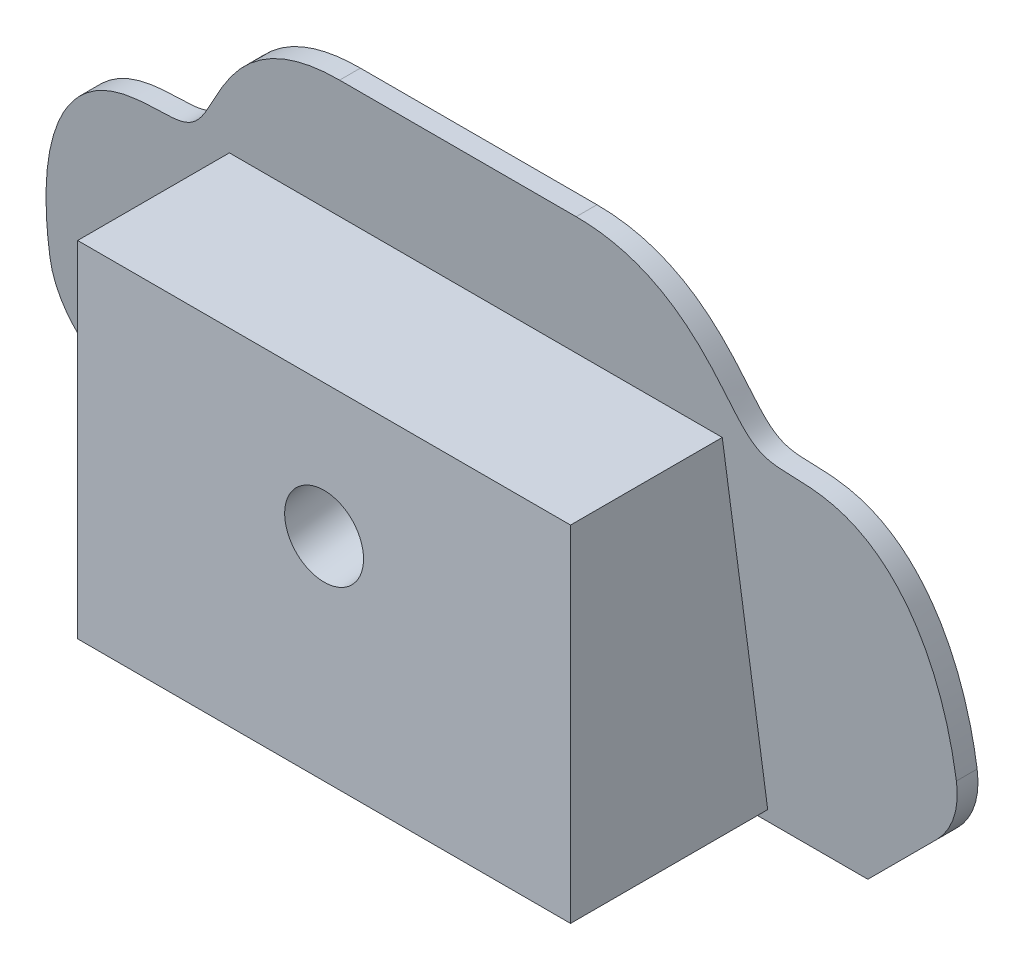
from build123d import *

# Parameters (mm, degrees)
BOSS_EXTRUDE1_START     = -25
BOSS_EXTRUDE1_DEPTH     = 50
CUT_EXTRUDE1_DEPTH      = 341.53226913
CUT_EXTRUDE1_DEPTH_BACK = 341.53226913
BOSS_EXTRUDE2_DEPTH     = 125
CUT_EXTRUDE2_DEPTH      = 356.316937075
CUT_EXTRUDE2_DEPTH_BACK = 356.316937075
SKETCH4_R               = 20
CUT_EXTRUDE3_DEPTH      = 356.316937075
CUT_EXTRUDE3_DEPTH_BACK = 356.316937075
SKETCH6_R               = 12.5


# Read off the part's stored shape, not the designer's step: Boss-Extrude1
with BuildPart() as part:
    # Boss-Extrude1 outline → Boss-Extrude1 (new body)
    with BuildSketch(Plane.XY.offset(BOSS_EXTRUDE1_START)):
        with BuildLine():
            Line((175, 0), (215.218833807, 40.218833807))
            ThreePointArc((215.218833807, 40.218833807), (226.057471223, 56.440000887), (229.863494748, 75.574172084))
            add(Edge.make_bspline(
                [(229.863494748, 75.574172084), (229.863497015, 220.574172084), (130.657195822, 208), (130.657198498, 108), (160, 250), (60, 250)],
                knots=[0, 0, 0, 0, 0, 0, 1, 1, 1, 1, 1, 1], degree=5))
            Line((60, 250), (-60, 250))
            add(Edge.make_bspline(
                [(-60, 250), (-160, 250), (-130.657198498, 108), (-130.657195822, 208), (-229.863497015, 220.574172084), (-229.863494748, 75.574172084)],
                knots=[0, 0, 0, 0, 0, 0, 1, 1, 1, 1, 1, 1], degree=5))
            ThreePointArc((-229.863494748, 75.574172084), (-226.057471223, 56.440000887), (-215.218833807, 40.218833807))
            Line((-215.218833807, 40.218833807), (-175, 0))
            Line((-175, 0), (175, 0))
        make_face()
    extrude(amount=BOSS_EXTRUDE1_DEPTH)

    # Sketch2 → Cut-Extrude1 (cut, two sides: drawn at the far end of the back side and taken through both)
    with BuildSketch(Plane(origin=(0, 0, 0), x_dir=(0, 0, -1), z_dir=(1, 0, 0)).offset(-CUT_EXTRUDE1_DEPTH_BACK)):
        Polygon((23.039732542, -10), (-12.506441807, 260), (35, 260), (35, -10), align=None)
        Polygon((-23.039732542, 260), (12.506441807, -10), (-35, -10), (-35, 260), align=None)
    extrude(amount=CUT_EXTRUDE1_DEPTH + CUT_EXTRUDE1_DEPTH_BACK, mode=Mode.SUBTRACT)

    # Sketch7 → Boss-Extrude2 (add, symmetric)
    with BuildSketch(Plane(origin=(0, 0, 0), x_dir=(0, 0, -1), z_dir=(1, 0, 0))):
        Polygon((-89.599998155, 6), (-89.599998155, 181), (-12.639185232, 181), (10.400001845, 6), align=None)
    extrude(amount=BOSS_EXTRUDE2_DEPTH, both=True)

    # Sketch4 → Cut-Extrude2 (cut, two sides: drawn at the far end of the back side and taken through both)
    with BuildSketch(Plane(origin=(0, 2.811189919, -21.353107392), x_dir=(-1, 0, 0), z_dir=(0, 0.13052619222005532, -0.99144486137381)).offset(-CUT_EXTRUDE2_DEPTH_BACK)):
        with Locations(Location((0, 124.321792579, 0), (0, 0, 90))):
            Circle(SKETCH4_R)
    extrude(amount=CUT_EXTRUDE2_DEPTH + CUT_EXTRUDE2_DEPTH_BACK, mode=Mode.SUBTRACT)

    # Sketch6 → Cut-Extrude3 (cut, two sides: drawn at the far end of the back side and taken through both)
    with BuildSketch(Plane(origin=(0, 2.811189919, -21.353107392), x_dir=(-1, 0, 0), z_dir=(0, 0.13052619222005532, -0.99144486137381)).offset(-CUT_EXTRUDE3_DEPTH_BACK)):
        with Locations(Location((150, 97.164552434, 0), (0, 0, 90))):
            Circle(SKETCH6_R)
    extrude(amount=CUT_EXTRUDE3_DEPTH + CUT_EXTRUDE3_DEPTH_BACK, mode=Mode.SUBTRACT)


solid = part.part
